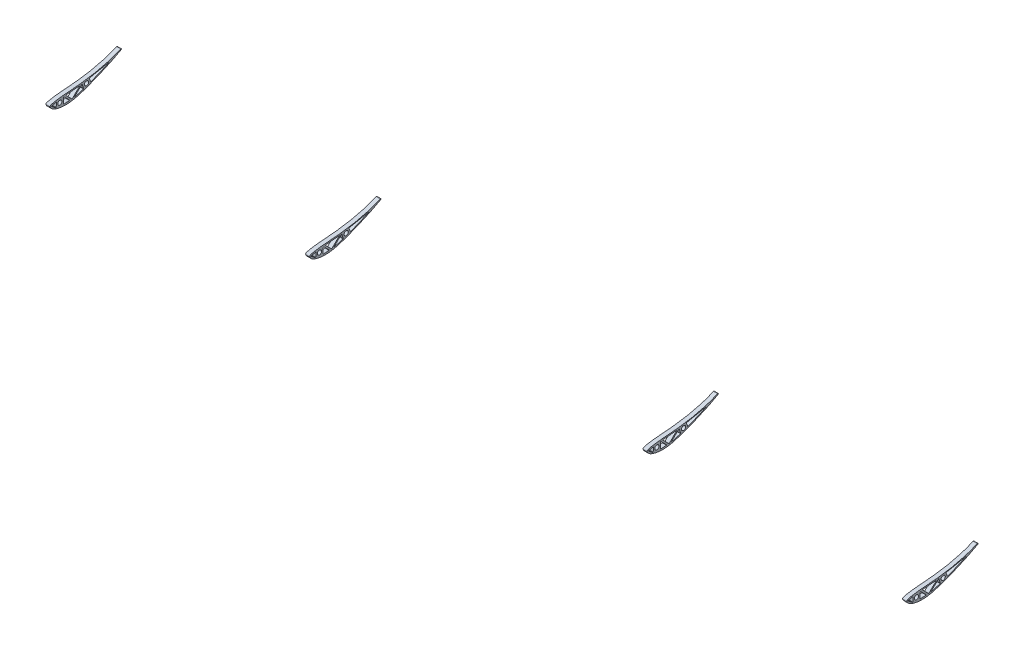
from build123d import *

# Parameters (mm, degrees)
BOSS_EXTRUDE1_START     = -6.35
BOSS_EXTRUDE1_OUTLINE_R = 3.2639
BOSS_EXTRUDE1_DEPTH     = 6.35


# Read off the part's stored shape, not the designer's step: Boss-Extrude1
with BuildPart() as part:
    # Boss-Extrude1 outline → Boss-Extrude1 (new body)
    with BuildSketch(Plane.ZY.offset(663.1865959).offset(BOSS_EXTRUDE1_START)):
        with BuildLine():
            ThreePointArc((1175.682537694, 124.32004407), (1174.543396647, 124.030006755), (1174.859846724, 122.89791872))
            add(Edge.make_bspline(
                [(1174.859846724, 122.89791872), (1175.456078921, 122.550123625), (1177.064804276, 121.627273229), (1179.778405386, 120.131252306), (1183.072514633, 118.392268289), (1186.587950486, 116.608141901), (1190.303042812, 114.789010353), (1194.197408386, 112.95046178), (1198.245556574, 111.100469637), (1202.425517583, 109.254764216), (1206.708733405, 107.419594116), (1211.068013954, 105.607690388), (1215.471135023, 103.829754474), (1219.8806463, 102.091611444), (1224.262398741, 100.41642796), (1228.582016239, 98.822776082), (1232.81447602, 97.341832651), (1236.939726175, 95.997432592), (1240.941286657, 94.821168654), (1244.793155753, 93.798560096), (1248.507582684, 93.003945067), (1252.090057311, 92.452113473), (1255.545265712, 92.10393223), (1258.874397679, 91.96064362), (1262.063816429, 91.984318469), (1265.09705975, 92.163797411), (1267.956470634, 92.480588536), (1270.624512755, 92.933589365), (1273.087628078, 93.502706031), (1275.330590281, 94.178036385), (1277.337006392, 94.94667236), (1279.099249454, 95.782957088), (1280.600092452, 96.705802994), (1281.831099878, 97.705994191), (1282.818404649, 98.735474755), (1283.551130515, 99.767835337), (1284.037621035, 100.77163473), (1284.238650092, 101.677072386), (1284.22848096, 102.559704631), (1283.481347796, 103.196964714), (1282.345163051, 103.563104148), (1280.784749736, 104.041184648), (1278.780803488, 104.487303796), (1276.374300038, 104.964723462), (1273.585405002, 105.443472223), (1270.443494496, 105.921774274), (1266.961485196, 106.388337391), (1263.12024775, 106.765298298), (1258.906871402, 107.076078316), (1254.324754116, 107.413399043), (1249.400849904, 107.792595225), (1244.174391416, 108.242238488), (1238.690959869, 108.785852681), (1232.999048426, 109.441404217), (1227.15383316, 110.226065151), (1221.211826206, 111.147492191), (1215.235127898, 112.219232372), (1209.285846084, 113.438469627), (1203.428883275, 114.802706832), (1197.73005259, 116.305624457), (1192.253305574, 117.93184212), (1187.060885128, 119.660990383), (1182.215155564, 121.472001401), (1178.462627073, 123.041230911), (1176.338148864, 124.011632923), (1175.682537694, 124.32004407)],
                knots=[0.066205888, 0.066205888, 0.066205888, 0.066205888, 0.07398925, 0.087118173, 0.101145049, 0.115990637, 0.131570422, 0.147788379, 0.164550917, 0.181757895, 0.199311955, 0.217095072, 0.234990228, 0.252856883, 0.270540594, 0.287886779, 0.304773438, 0.321101419, 0.336806063, 0.351800033, 0.366031063, 0.379615675, 0.392652963, 0.405170359, 0.417171919, 0.428603517, 0.439418959, 0.449596586, 0.459102079, 0.467907878, 0.475988301, 0.483308969, 0.489874508, 0.49580325, 0.501149412, 0.505903073, 0.510046769, 0.513579311, 0.516446927, 0.519350053, 0.523823355, 0.529973794, 0.537715654, 0.546967844, 0.557637367, 0.569620481, 0.582804124, 0.597246961, 0.613135037, 0.6304436, 0.649056124, 0.668822257, 0.689594964, 0.711189651, 0.733426689, 0.756094118, 0.778988554, 0.801889683, 0.824566598, 0.846792285, 0.868338291, 0.888978163, 0.908492011, 0.926658768, 0.934828484, 0.934828484, 0.934828484, 0.934828484], degree=3))
        make_face()
        with Locations((1228.09081556, 104.71412219)):
            Circle(BOSS_EXTRUDE1_OUTLINE_R, mode=Mode.SUBTRACT)
        with BuildLine():
            ThreePointArc((1254.420270069, 95.008190513), (1254.19946486, 95.172323092), (1254.257644608, 95.441227463))
            Line((1254.257644608, 95.441227463), (1262.919797873, 104.103380729))
            ThreePointArc((1262.919797873, 104.103380729), (1263.188702244, 104.161560476), (1263.352834823, 103.940755267))
            Line((1263.352834823, 103.940755267), (1263.974865169, 94.656571655))
            ThreePointArc((1263.974865169, 94.656571655), (1263.901038464, 94.459986872), (1263.704453681, 94.386160167))
            Line((1263.704453681, 94.386160167), (1254.420270069, 95.008190513))
        make_face(mode=Mode.SUBTRACT)
        with Locations((1269.205113593, 99.515710009)):
            Circle(BOSS_EXTRUDE1_OUTLINE_R, mode=Mode.SUBTRACT)
        with BuildLine():
            ThreePointArc((1274.270231755, 102.753921217), (1274.354505025, 102.970727174), (1274.579950075, 103.028010121))
            Line((1274.579950075, 103.028010121), (1281.93673654, 101.330290167))
            ThreePointArc((1281.93673654, 101.330290167), (1282.1276583, 101.137513223), (1282.035565852, 100.882301449))
            Line((1282.035565852, 100.882301449), (1275.400798218, 95.721782621))
            ThreePointArc((1275.400798218, 95.721782621), (1275.14537548, 95.688566955), (1274.992250585, 95.895682436))
            Line((1274.992250585, 95.895682436), (1274.270231755, 102.753921217))
        make_face(mode=Mode.SUBTRACT)
        with BuildLine():
            ThreePointArc((1234.823205163, 106.893809204), (1235.003310176, 107.063079681), (1235.242048714, 106.999093587))
            Line((1235.242048714, 106.999093587), (1246.510259, 96.072818299))
            ThreePointArc((1246.510259, 96.072818299), (1246.553642869, 95.763867849), (1246.264818936, 95.645913298))
            Line((1246.264818936, 95.645913298), (1232.727059603, 99.444663482))
            ThreePointArc((1232.727059603, 99.444663482), (1232.572107706, 99.568676353), (1232.553656116, 99.7662841))
            Line((1232.553656116, 99.7662841), (1234.823205163, 106.893809204))
        make_face(mode=Mode.SUBTRACT)
        with BuildLine():
            ThreePointArc((1238.623976245, 106.440464263), (1238.570063293, 106.729020487), (1238.824326727, 106.87572225))
            Line((1238.824326727, 106.87572225), (1259.748060401, 104.928739423))
            ThreePointArc((1259.748060401, 104.928739423), (1259.962776547, 104.763883983), (1259.906877541, 104.499014883))
            Line((1259.906877541, 104.499014883), (1250.740321015, 95.045593309))
            ThreePointArc((1250.740321015, 95.045593309), (1250.561883218, 94.968440536), (1250.381153393, 95.040059863))
            Line((1250.381153393, 95.040059863), (1238.623976245, 106.440464263))
        make_face(mode=Mode.SUBTRACT)
        with BuildLine():
            ThreePointArc((1223.621410779, 109.573819136), (1223.7950598, 109.44552096), (1223.807260193, 109.229962256))
            Line((1223.807260193, 109.229962256), (1221.518179936, 103.539054396))
            ThreePointArc((1221.518179936, 103.539054396), (1221.380310878, 103.399417267), (1221.184080587, 103.3996963))
            Line((1221.184080587, 103.3996963), (1193.300229843, 115.123696895))
            ThreePointArc((1193.300229843, 115.123696895), (1193.155849384, 115.432341658), (1193.448479778, 115.60691187))
            Line((1193.448479778, 115.60691187), (1223.621410779, 109.573819136))
        make_face(mode=Mode.SUBTRACT)
    extrude(amount=BOSS_EXTRUDE1_DEPTH)


with BuildPart() as body_2:
    # Mirror5: mirrored copy
    add(part.part.mirror(Plane(origin=(-459.9865959, 0, 0), x_dir=(0, 0, 1), z_dir=(1, 0, 0))))


with BuildPart() as body_3:
    # Mirror6: mirrored copy
    add(body_2.part.mirror(Plane(origin=(0, 0, 0), x_dir=(0, 0, 1), z_dir=(1, 0, 0))))


with BuildPart() as body_4:
    # Mirror7: mirrored copy
    add(body_3.part.mirror(Plane(origin=(459.9865959, 0, 0), x_dir=(0, 0, 1), z_dir=(1, 0, 0))))


solid = Compound([part.part, body_2.part, body_3.part, body_4.part])
